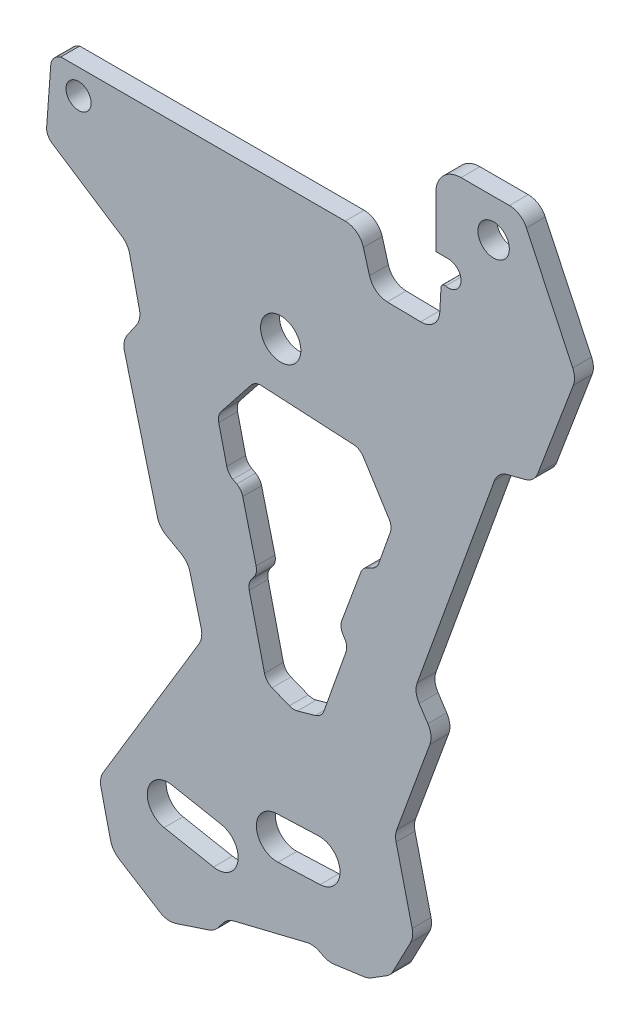
from build123d import *
from OCP.BRepFilletAPI import BRepFilletAPI_MakeFillet

# Parameters (mm, degrees)
CUT_EXTRUDE1_START         = -1.5
CUT_EXTRUDE1_DEPTH         = 1.5
CUT_EXTRUDE2_DEPTH         = 56.320855182
CUT_EXTRUDE3_DEPTH         = 56.320855182
FILLET1_R1                 = 2
FILLET1_R2                 = 1.5
FILLET1_R3                 = 1.5
FILLET1_R4                 = 1.5
FILLET1_R5                 = 1
FILLET1_R6                 = 1
FILLET1_R7                 = 0.3
F_2_0_2_DIAMETER_HOLE1_D   = 2
F_2_5_2_5_DIAMETER_HOLE1_D = 2.5
F_3_2_3_2_DIAMETER_HOLE1_D = 3.2


with BuildPart() as part:
    # Cut-Extrude1: read off the stored shape, not the designer's step
    # Cut-Extrude1 outline → Cut-Extrude1 (new body)
    with BuildSketch(Plane.XY.offset(1.5).offset(CUT_EXTRUDE1_START)):
        with BuildLine():
            Line((-21.15922941, 42.990956489), (-21.918524362, 42.593852668))
            Line((-21.918524362, 42.593852668), (-22.331690837, 37.008180338))
            Line((-22.331690837, 37.008180338), (-15.823880633, 32.753073704))
            Line((-15.823880633, 32.753073704), (-14.767696121, 28.083626208))
            Line((-14.767696121, 28.083626208), (-16.26955663, 25.9101387))
            Line((-16.26955663, 25.9101387), (-13.325866142, 14.548277254))
            Line((-13.325866142, 14.548277254), (-11.044500218, 13.256714261))
            Line((-11.044500218, 13.256714261), (-9.843169723, 8.619898436))
            Line((-9.843169723, 8.619898436), (-18.106030722, -5.122739041))
            Line((-18.106030722, -5.122739041), (-17.064214449, -9.58485809))
            Line((-17.064214449, -9.58485809), (-12.690100502, -12.329039203))
            Line((-12.690100502, -12.329039203), (-8.962822896, -11.10580142))
            Line((-8.962822896, -11.10580142), (-7.911354227, -9.756154848))
            Line((-7.911354227, -9.756154848), (-1.053266461, -8.076943446))
            Line((-1.053266461, -8.076943446), (0.097779189, -8.690341842))
            Line((0.097779189, -8.690341842), (3.254584825, -8.251896615))
            Line((3.254584825, -8.251896615), (5.068180176, -7.125558451))
            Line((5.068180176, -7.125558451), (6.906602667, -3.594529202))
            Line((6.906602667, -3.594529202), (5.391678643, 2.702231034))
            Line((5.391678643, 2.702231034), (8.443636754, 11.032011447))
            Line((8.443636754, 11.032011447), (6.916630149, 13.34590119))
            Line((6.916630149, 13.34590119), (13.586412116, 31.791123225))
            Line((13.586412116, 31.791123225), (16.484018961, 32.532910561))
            Line((16.484018961, 32.532910561), (19.81145552, 41.346140579))
            Line((19.81145552, 41.346140579), (15.452897729, 50.590933994))
            Line((15.452897729, 50.590933994), (8.66072149, 50.590933994))
            Line((8.66072149, 50.590933994), (8.66072149, 44.490933994))
            Line((8.66072149, 44.490933994), (9.66072149, 44.490933994))
            ThreePointArc((9.66072149, 44.490933994), (10.615066101, 43.192226171), (9.090581088, 42.66938672))
            Line((9.090581088, 42.66938672), (8.890254379, 39.021331889))
            Line((8.890254379, 39.021331889), (3.686776041, 39.121354833))
            Line((3.686776041, 39.121354833), (2.58727318, 42.990956489))
            Line((2.58727318, 42.990956489), (-21.15922941, 42.990956489))
        make_face()
        with BuildLine():
            ThreePointArc((-3.894243345, -3.831676855), (-5.608872185, -2.248942531), (-4.026137862, -0.534313691))
            Line((-4.026137862, -0.534313691), (-0.677019452, -0.400348965))
            ThreePointArc((-0.677019452, -0.400348965), (1.037609388, -1.983083289), (-0.545124935, -3.697712129))
            Line((-0.545124935, -3.697712129), (-3.894243345, -3.831676855))
        make_face(mode=Mode.SUBTRACT)
    extrude(amount=CUT_EXTRUDE1_DEPTH)

    # Sketch2 → Cut-Extrude2 (cut, through all)
    with BuildSketch(Plane.XY.offset(1.5)):
        with BuildLine():
            Line((-8.400629557, -3.479539033), (-12.328216542, -2.729986131))
            ThreePointArc((-12.328216542, -2.729986131), (-14.258274586, -4.041426541), (-12.946834177, -5.971484585))
            Line((-12.946834177, -5.971484585), (-9.019247192, -6.721037486))
            ThreePointArc((-9.019247192, -6.721037486), (-7.089189148, -5.409597077), (-8.400629557, -3.479539033))
        make_face()
    extrude(amount=-CUT_EXTRUDE2_DEPTH, mode=Mode.SUBTRACT)

    # Sketch3 → Cut-Extrude3 (cut, through all)
    with BuildSketch(Plane(origin=(0, 0, 0), x_dir=(-1, 0, 0), z_dir=(0, 0, -1))):
        Polygon((-1.669040668, 13.788566276), (0.421242883, 7.902808428), (2.674335505, 7.270595549), (4.846116127, 8.142081874), (6.289526399, 14.218922957), (5.51540188, 15.234387716), (6.801285994, 20.3627961), (7.865027392, 20.96090236), (8.717011471, 24.560534964), (5.714933344, 28.35768306), (-2.622436807, 27.906842737), (-5.197547994, 23.808110114), (-3.962369217, 20.321340098), (-2.840334409, 19.841428909), (-1.008931735, 14.881586698), align=None)
    extrude(amount=-CUT_EXTRUDE3_DEPTH, mode=Mode.SUBTRACT)

    # Fillet1: one fillet with a radius per group of edges: ONE call of the kernel's fillet builder (fillet() takes one radius for all edges)
    fillet1_edges_1 = [part.edges().sort_by_distance(p)[0] for p in [
        (8.66072149, 50.590933994, 0.75),
    ]]
    fillet1_edges_2 = [part.edges().sort_by_distance(p)[0] for p in [
        (-13.325866142, 14.548277254, 0.75),
        (2.58727318, 42.990956489, 0.75),
        (8.890254379, 39.021331889, 0.75),
        (-8.962822896, -11.10580142, 0.75),
        (-17.064214449, -9.58485809, 0.75),
        (-9.843169723, 8.619898436, 0.75),
        (-15.823880633, 32.753073704, 0.75),
        (13.586412116, 31.791123225, 0.75),
        (-12.690100502, -12.329039203, 0.75),
        (8.443636754, 11.032011447, 0.75),
        (-18.106030722, -5.122739041, 0.75),
        (5.391678643, 2.702231034, 0.75),
        (-11.044500218, 13.256714261, 0.75),
        (6.906602667, -3.594529202, 0.75),
        (-16.26955663, 25.9101387, 0.75),
        (3.686776041, 39.121354833, 0.75),
        (3.254584825, -8.251896615, 0.75),
        (16.484018961, 32.532910561, 0.75),
        (0.097779189, -8.690341842, 0.75),
        (-7.911354227, -9.756154848, 0.75),
        (-14.767696121, 28.083626208, 0.75),
    ]]
    fillet1_edges_3 = [part.edges().sort_by_distance(p)[0] for p in [
        (15.452897729, 50.590933994, 0.75),
        (19.81145552, 41.346140579, 0.75),
    ]]
    fillet1_edges_4 = [part.edges().sort_by_distance(p)[0] for p in [
        (-1.053266461, -8.076943446, 0.75),
        (6.916630149, 13.34590119, 0.75),
        (5.068180176, -7.125558451, 0.75),
    ]]
    fillet1_edges_5 = [part.edges().sort_by_distance(p)[0] for p in [
        (-6.801285994, 20.3627961, 0.75),
        (5.197547994, 23.808110114, 0.75),
    ]]
    fillet1_edges_6 = [part.edges().sort_by_distance(p)[0] for p in [
        (1.008931735, 14.881586698, 0.75),
        (1.669040668, 13.788566276, 0.75),
        (-21.918524362, 42.593852668, 0.75),
        (2.840334409, 19.841428909, 0.75),
        (-22.331690837, 37.008180338, 0.75),
        (-0.421242883, 7.902808428, 0.75),
        (-6.289526399, 14.218922957, 0.75),
        (-2.674335505, 7.270595549, 0.75),
        (-5.51540188, 15.234387716, 0.75),
        (-4.846116127, 8.142081874, 0.75),
        (3.962369217, 20.321340098, 0.75),
        (2.622436807, 27.906842737, 0.75),
        (-7.865027392, 20.96090236, 0.75),
        (-5.714933344, 28.35768306, 0.75),
        (-8.717011471, 24.560534964, 0.75),
    ]]
    fillet1_edges_7 = [part.edges().sort_by_distance(p)[0] for p in [
        (9.090581088, 42.66938672, 0.75),
    ]]
    fillet1 = BRepFilletAPI_MakeFillet(part.part.solid().wrapped)
    for e in fillet1_edges_1:
        fillet1.Add(FILLET1_R1, e.wrapped)
    for e in fillet1_edges_2:
        fillet1.Add(FILLET1_R2, e.wrapped)
    for e in fillet1_edges_3:
        fillet1.Add(FILLET1_R3, e.wrapped)
    for e in fillet1_edges_4:
        fillet1.Add(FILLET1_R4, e.wrapped)
    for e in fillet1_edges_5:
        fillet1.Add(FILLET1_R5, e.wrapped)
    for e in fillet1_edges_6:
        fillet1.Add(FILLET1_R6, e.wrapped)
    for e in fillet1_edges_7:
        fillet1.Add(FILLET1_R7, e.wrapped)
    add(Compound.cast(fillet1.Shape()), mode=Mode.REPLACE)

    # Ø2.0 (2) Diameter Hole1 (through all)
    with Locations(Plane(origin=(0, 0, 0), x_dir=(-1, 0, 0), z_dir=(0, 0, -1))):
        with Locations((19.749063689, 41.009673781)):
            Hole(F_2_0_2_DIAMETER_HOLE1_D / 2)

    # Ø2.5 (2.5) Diameter Hole1 (through all)
    with Locations(Plane(origin=(0, 0, 0), x_dir=(-1, 0, 0), z_dir=(0, 0, -1))):
        with Locations((-13.25072149, 47.590933994)):
            Hole(F_2_5_2_5_DIAMETER_HOLE1_D / 2)

    # Ø3.2 (3.2) Diameter Hole1 (through all)
    with Locations(Plane(origin=(0, 0, 0), x_dir=(-1, 0, 0), z_dir=(0, 0, -1))):
        with Locations((3.676270681, 32.308049922)):
            Hole(F_3_2_3_2_DIAMETER_HOLE1_D / 2)


solid = part.part
